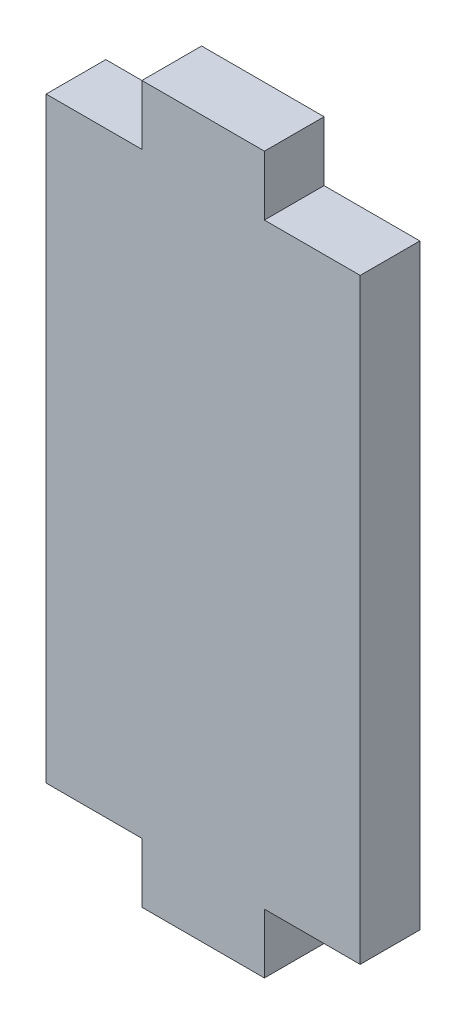
from build123d import *

# Parameters (mm, degrees)
SKETCH1_W           = 25.4
SKETCH1_H           = 57.912
BOSS_EXTRUDE1_DEPTH = 4.826
SKETCH2_W           = 7.747
SKETCH2_H           = 4.826
CUT_EXTRUDE1_DEPTH  = 64.421211121


with BuildPart() as part:
    # Sketch1 → Boss-Extrude1 (new body)
    with BuildSketch(Plane.XY):
        with Locations((12.7, 28.956)):
            Rectangle(SKETCH1_W, SKETCH1_H)
    extrude(amount=BOSS_EXTRUDE1_DEPTH)

    # Sketch2 → Cut-Extrude1 (cut, through all)
    with BuildSketch(Plane.XY.offset(4.826)):
        with Locations((3.8735, 55.499)):
            Rectangle(SKETCH2_W, SKETCH2_H)
        with Locations((21.5265, 55.499)):
            Rectangle(SKETCH2_W, SKETCH2_H)
        with Locations((3.8735, 2.413)):
            Rectangle(SKETCH2_W, SKETCH2_H)
        with Locations((21.5265, 2.413)):
            Rectangle(SKETCH2_W, SKETCH2_H)
    extrude(amount=-CUT_EXTRUDE1_DEPTH, mode=Mode.SUBTRACT)


solid = part.part
